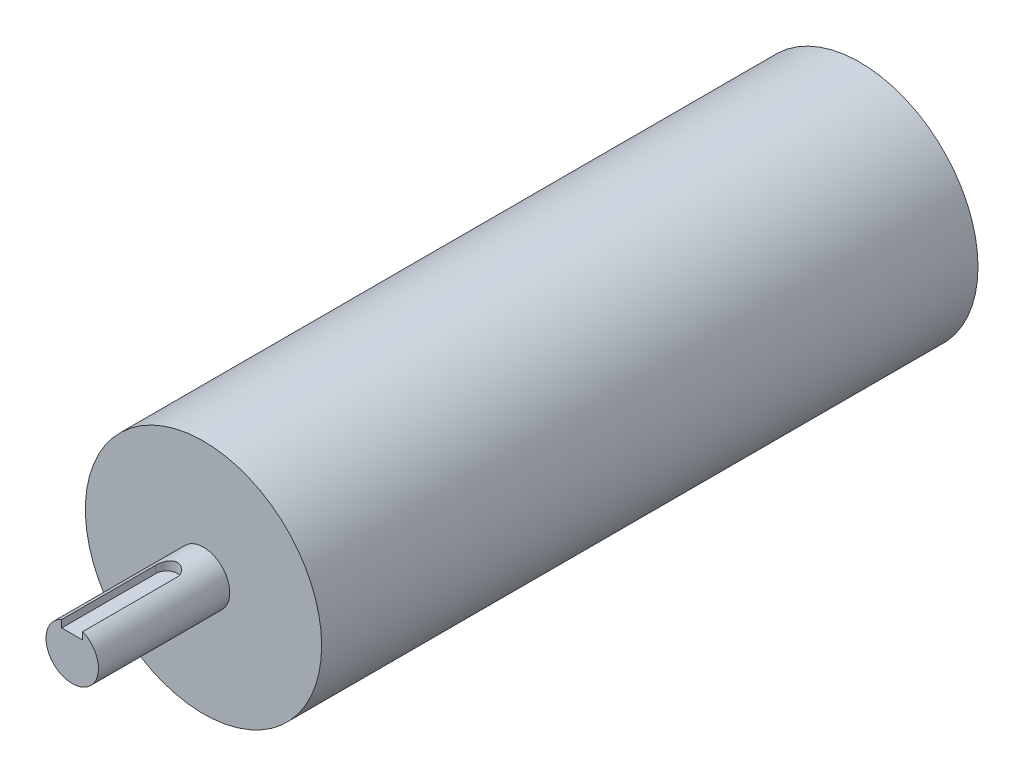
from build123d import *

# Parameters (mm, degrees)
SKETCH1_R           = 22.5
BOSS_EXTRUDE1_DEPTH = 125
SKETCH3_R           = 5
BOSS_EXTRUDE2_DEPTH = 25
CUT_EXTRUDE1_START  = -20
CUT_EXTRUDE1_DEPTH  = 20
FILLET1_R           = 2


with BuildPart() as part:
    # Sketch1 → Boss-Extrude1 (new body)
    with BuildSketch(Plane.XY):
        Circle(SKETCH1_R)
    extrude(amount=BOSS_EXTRUDE1_DEPTH)

    # Sketch3 → Boss-Extrude2 (add)
    with BuildSketch(Plane.XY.offset(125)):
        Circle(SKETCH3_R)
    extrude(amount=BOSS_EXTRUDE2_DEPTH)

    # Sketch4 → Cut-Extrude1 (cut)
    with BuildSketch(Plane.XY.offset(150).offset(CUT_EXTRUDE1_START)):
        with BuildLine():
            Line((-2, 3.184954178), (2, 3.184954178))
            Line((2, 3.184954178), (2, 4.582575695))
            ThreePointArc((2, 4.582575695), (0, 5), (-2, 4.582575695))
            Line((-2, 4.582575695), (-2, 3.184954178))
        make_face()
    extrude(amount=CUT_EXTRUDE1_DEPTH, mode=Mode.SUBTRACT)

    # Fillet1
    fillet1_edges = [part.edges().sort_by_distance(p)[0] for p in [
        (-2, 3.883764937, 130),
        (2, 3.883764937, 130),
    ]]
    fillet(fillet1_edges, radius=FILLET1_R - 0.0001)  # a hair under: the kernel refuses the full size


solid = part.part
